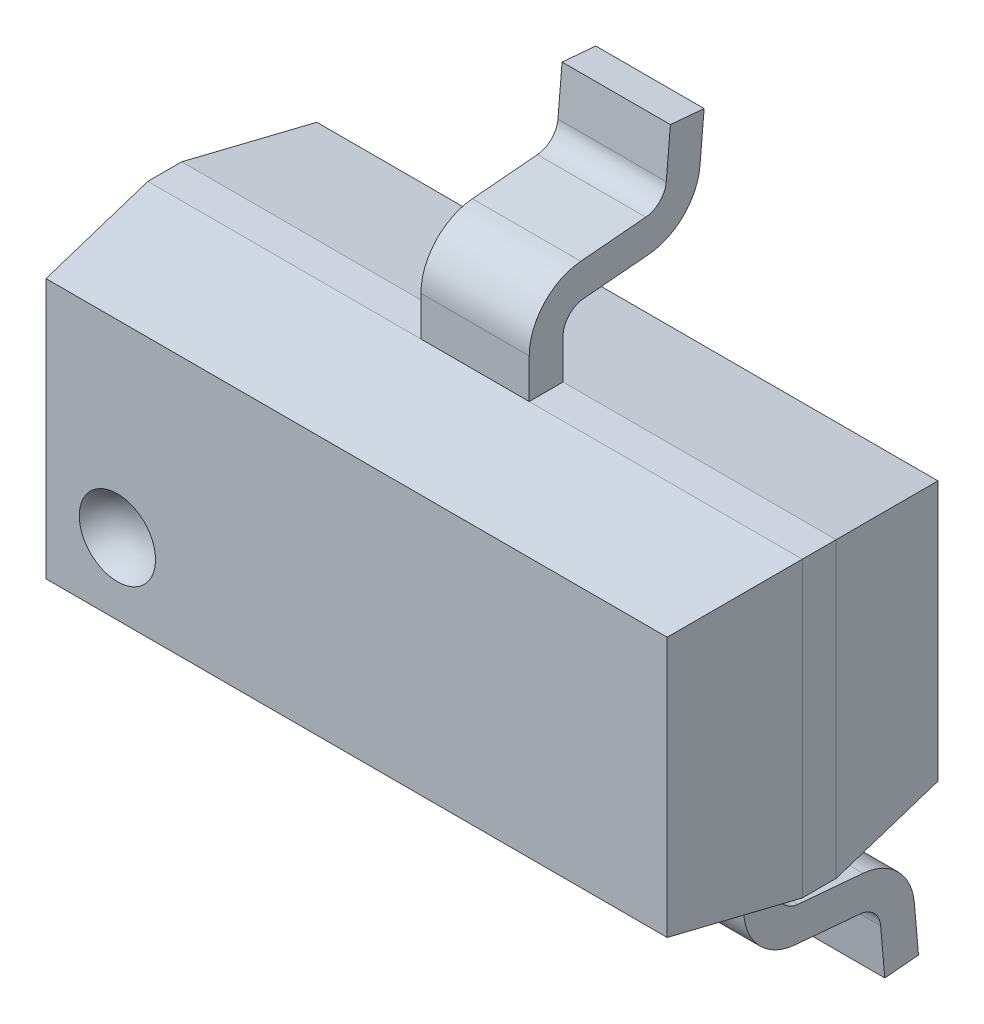
from build123d import *
from OCP.BRepFilletAPI import BRepFilletAPI_MakeChamfer
from build123d.topology import SkipClean

# Parameters (mm, degrees)
BODYWXH_W               = 1.2
BODYWXH_H               = 1.3
BOSS_BODY_DEPTH         = 1.45
CHAMFER1_SIZE           = 0.525
CHAMFER1_SIZE2          = 0.073783938
PINS_DEPTH              = 0.48
PATTERNLEADS_COUNT      = 3
PATTERNLEADS_PITCH      = 0.95
DELETEFACE1_START       = 0.65
DELETEFACE1_OUTLINE_W   = 0.48
DELETEFACE1_OUTLINE_H   = 1.775
DELETEFACE1_DEPTH       = 0.75
DELETEFACE1_START_2     = -1.4
DELETEFACE1_2_OUTLINE_W = 0.48
DELETEFACE1_2_OUTLINE_H = 1.775
DELETEFACE1_2_DEPTH     = 0.75


# Read off the part's stored shape, not the designer's step: DeleteFace1
with BuildPart() as part:
    # BodyWxH → Boss-Body (new, symmetric)
    with BuildSketch(Plane(origin=(0, 0, 0), x_dir=(0, 0, -1), z_dir=(1, 0, 0))):
        with Locations((-0.7, 0)):
            Rectangle(BODYWXH_W, BODYWXH_H)
    extrude(amount=BOSS_BODY_DEPTH, both=True)

    # Chamfer1: one chamfer whose edges measure the first distance from different faces: ONE call of the kernel's chamfer builder (chamfer() names one face for all edges)
    chamfer1_edges_1 = [part.edges().sort_by_distance(p)[0] for p in [
        (1.45, 0, 0.1),
        (1.45, 0, 1.3),
    ]]
    chamfer1_side_1 = [part.faces().sort_by_distance(p)[0] for p in [
        (1.45, 0, 0.7),
    ]]
    chamfer1_edges_2 = [part.edges().sort_by_distance(p)[0] for p in [
        (-1.45, 0, 0.1),
        (-1.45, 0, 1.3),
    ]]
    chamfer1_side_2 = [part.faces().sort_by_distance(p)[0] for p in [
        (-1.45, 0, 0.7),
    ]]
    chamfer1_edges_3 = [part.edges().sort_by_distance(p)[0] for p in [
        (0, 0.65, 1.3),
        (0, 0.65, 0.1),
    ]]
    chamfer1_side_3 = [part.faces().sort_by_distance(p)[0] for p in [
        (0, 0.65, 0.7),
    ]]
    chamfer1_edges_4 = [part.edges().sort_by_distance(p)[0] for p in [
        (0, -0.65, 0.1),
        (0, -0.65, 1.3),
    ]]
    chamfer1_side_4 = [part.faces().sort_by_distance(p)[0] for p in [
        (0, -0.65, 0.7),
    ]]
    chamfer1 = BRepFilletAPI_MakeChamfer(part.part.solid().wrapped)
    for e in chamfer1_edges_1:
        chamfer1.Add(CHAMFER1_SIZE, CHAMFER1_SIZE2, e.wrapped, chamfer1_side_1[0].wrapped)  # the first distance lies on this face
    for e in chamfer1_edges_2:
        chamfer1.Add(CHAMFER1_SIZE, CHAMFER1_SIZE2, e.wrapped, chamfer1_side_2[0].wrapped)  # the first distance lies on this face
    for e in chamfer1_edges_3:
        chamfer1.Add(CHAMFER1_SIZE, CHAMFER1_SIZE2, e.wrapped, chamfer1_side_3[0].wrapped)  # the first distance lies on this face
    for e in chamfer1_edges_4:
        chamfer1.Add(CHAMFER1_SIZE, CHAMFER1_SIZE2, e.wrapped, chamfer1_side_4[0].wrapped)  # the first distance lies on this face
    add(Compound.cast(chamfer1.Shape()), mode=Mode.REPLACE)

    # LeadCross → Pins (add)
    with BuildSketch(Plane(origin=(-1.19, 0, 0), x_dir=(0, 0, -1), z_dir=(1, 0, 0))):
        with BuildLine():
            Line((0, -1.386926639), (-0.149429205, -1.4))
            Line((-0.149429205, -1.4), (-0.167772682, -1.1903331))
            ThreePointArc((-0.167772682, -1.1903331), (-0.196681473, -1.128337996), (-0.258676577, -1.099429205))
            Line((-0.258676577, -1.099429205), (-0.546788936, -1.07422264))
            ThreePointArc((-0.546788936, -1.07422264), (-0.709319334, -0.994071517), (-0.775, -0.825173965))
            Line((-0.775, -0.825173965), (-0.775, 0.825173965))
            ThreePointArc((-0.775, 0.825173965), (-0.709319334, 0.994071517), (-0.546788936, 1.07422264))
            Line((-0.546788936, 1.07422264), (-0.258676577, 1.099429205))
            ThreePointArc((-0.258676577, 1.099429205), (-0.196681473, 1.128337996), (-0.167772682, 1.1903331))
            Line((-0.167772682, 1.1903331), (-0.149429205, 1.4))
            Line((-0.149429205, 1.4), (0, 1.386926639))
            Line((0, 1.386926639), (-0.018343477, 1.177259739))
            ThreePointArc((-0.018343477, 1.177259739), (-0.090615456, 1.022271979), (-0.245603216, 0.95))
            Line((-0.245603216, 0.95), (-0.533715574, 0.924793435))
            ThreePointArc((-0.533715574, 0.924793435), (-0.598727734, 0.892732986), (-0.625, 0.825173965))
            Line((-0.625, 0.825173965), (-0.625, -0.825173965))
            ThreePointArc((-0.625, -0.825173965), (-0.598727734, -0.892732986), (-0.533715574, -0.924793435))
            Line((-0.533715574, -0.924793435), (-0.245603216, -0.95))
            ThreePointArc((-0.245603216, -0.95), (-0.090615456, -1.022271979), (-0.018343477, -1.177259739))
            Line((-0.018343477, -1.177259739), (0, -1.386926639))
        make_face()
    pins = extrude(amount=PINS_DEPTH)

    # PatternLeads: Pins ×3
    with Locations(*[(i * PATTERNLEADS_PITCH, 0, 0) for i in range(1, PATTERNLEADS_COUNT)]):
        add(pins)

    # Pin1Indent → Cut-Pin1Indent (revolve, cut)
    with SkipClean():  # the faces are left unmerged after this step: merging them gives an invalid solid
        with BuildSketch(Plane(origin=(-1.06, 0, 0), x_dir=(0, 0, -1), z_dir=(1, 0, 0))):
            with BuildLine():
                Line((-1.3975, -0.065), (-1.3975, -0.455))
                ThreePointArc((-1.3975, -0.455), (-1.2025, -0.26), (-1.3975, -0.065))
            make_face()
        revolve(axis=Axis((-1.06, -0.065, 1.3975), (0, -1, 0)), mode=Mode.SUBTRACT)

    # DeleteFace1 outline → DeleteFace1 (cut)
    with SkipClean():  # the faces are left unmerged after this step: merging them gives an invalid solid
        with BuildSketch(Plane(origin=(0, 0, 0), x_dir=(1, 0, 0), z_dir=(0, 1, 0)).offset(DELETEFACE1_START)):
            with Locations((-0.95, 0.1125)):
                Rectangle(DELETEFACE1_OUTLINE_W, DELETEFACE1_OUTLINE_H)
            with Locations((0.95, 0.1125)):
                Rectangle(DELETEFACE1_OUTLINE_W, DELETEFACE1_OUTLINE_H)
        extrude(amount=DELETEFACE1_DEPTH, mode=Mode.SUBTRACT)

    # DeleteFace1 2 outline → DeleteFace1 2 (cut)
    with SkipClean():  # the faces are left unmerged after this step: merging them gives an invalid solid
        with BuildSketch(Plane(origin=(0, 0, 0), x_dir=(1, 0, 0), z_dir=(0, 1, 0)).offset(DELETEFACE1_START_2)):
            with Locations((0, 0.1125)):
                Rectangle(DELETEFACE1_2_OUTLINE_W, DELETEFACE1_2_OUTLINE_H)
        extrude(amount=DELETEFACE1_2_DEPTH, mode=Mode.SUBTRACT)


solid = part.part
